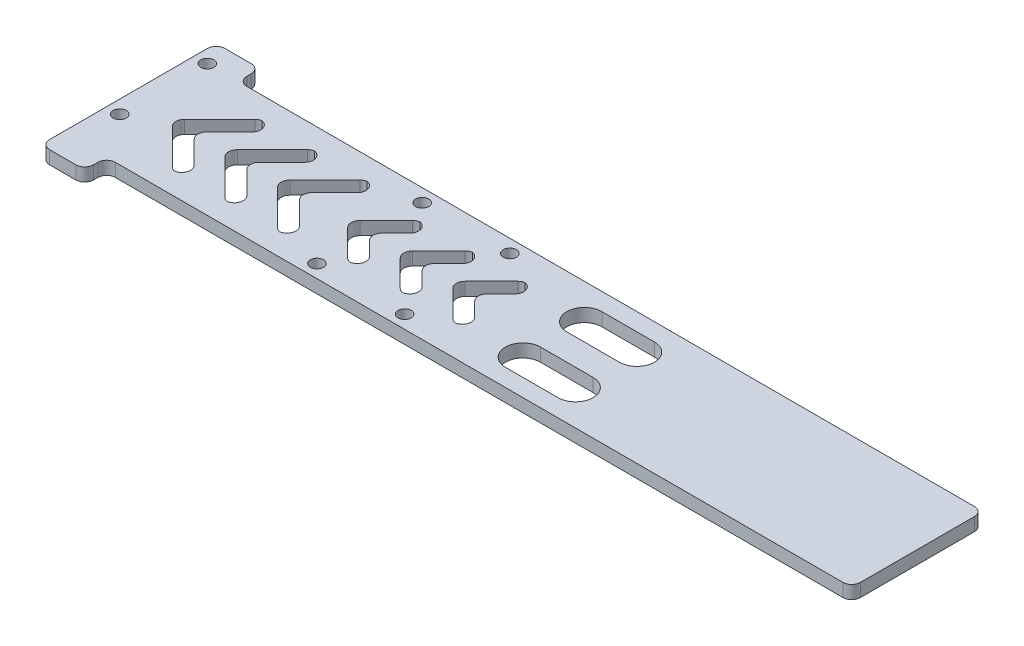
from build123d import *

# Parameters (mm, degrees)
SKETCH_1_R          = 1.5
EXTRUDE_1_DEPTH     = 3
CUT_EXTRUDE_1_DEPTH = 182.132548152
FILLET_1_R          = 2


with BuildPart() as part:
    # 草图1 → 凸台-拉伸1 (new body)
    with BuildSketch(Plane(origin=(0, 0, 0), x_dir=(1, 0, 0), z_dir=(0, 1, 0))):
        Polygon((10, -15), (180, -15), (180, 15), (10, 15), (10, 20), (0, 20), (0, -20), (10, -20), align=None)
        with Locations(Location((55, -12, 0), (0, 0, 270))):
            Circle(SKETCH_1_R, mode=Mode.SUBTRACT)
        with Locations(Location((75, -12, 0), (0, 0, 270))):
            Circle(SKETCH_1_R, mode=Mode.SUBTRACT)
        with Locations(Location((3, 15, 0), (0, 0, 270))):
            Circle(SKETCH_1_R, mode=Mode.SUBTRACT)
        with Locations(Location((3, -5, 0), (0, 0, 270))):
            Circle(SKETCH_1_R, mode=Mode.SUBTRACT)
        with Locations(Location((75, 12, 0), (0, 0, 270))):
            Circle(SKETCH_1_R, mode=Mode.SUBTRACT)
        with Locations(Location((55, 12, 0), (0, 0, 270))):
            Circle(SKETCH_1_R, mode=Mode.SUBTRACT)
    extrude(amount=EXTRUDE_1_DEPTH)

    # 草图2 → 切除-拉伸1 (cut, through all)
    with BuildSketch(Plane(origin=(0, 3, 0), x_dir=(1, 0, 0), z_dir=(0, 1, 0))):
        Polygon((20, 10), (10, 0), (20, -10), (25, -10), (15, 0), (25, 10), align=None)
        Polygon((32, -10), (22, 0), (32, 10), (37, 10), (27, 0), (37, -10), align=None)
        Polygon((44, -10), (34, 0), (44, 10), (49, 10), (39, 0), (49, -10), align=None)
        Polygon((50, 0), (58, 8), (63, 8), (55, 0), (63, -8), (58, -8), align=None)
        Polygon((75, -8), (67, 0), (75, 8), (70, 8), (62, 0), (70, -8), align=None)
        Polygon((87, -8), (79, 0), (87, 8), (82, 8), (74, 0), (82, -8), align=None)
        with BuildLine():
            Line((97, 11), (109, 11))
            ThreePointArc((109, 11), (113, 7), (109, 3))
            Line((109, 3), (97, 3))
            ThreePointArc((97, 3), (93, 7), (97, 11))
        make_face()
        with BuildLine():
            Line((97, -11), (109, -11))
            ThreePointArc((109, -11), (113, -7), (109, -3))
            Line((109, -3), (97, -3))
            ThreePointArc((97, -3), (93, -7), (97, -11))
        make_face()
    extrude(amount=-CUT_EXTRUDE_1_DEPTH, mode=Mode.SUBTRACT)

    # 圆角1
    # the kernel refuses this fillet: 2 mm, written as the material it adds along each edge
    with BuildSketch(Plane(origin=(10, 0, -15), x_dir=(1, 0, 0), z_dir=(0, 1, 0)), Plane(origin=(10, 3, 0), x_dir=(0.7071067811865515, 0, -0.7071067811865436), z_dir=(0, -1, 0)), Plane(origin=(34, 3, 0), x_dir=(0.7071067811865507, 0, -0.7071067811865445), z_dir=(0, -1, 0)), Plane(origin=(22, 3, 0), x_dir=(0.7071067811865511, 0, -0.7071067811865441), z_dir=(0, -1, 0)), Plane(origin=(62, 3, 0), x_dir=(0.7071067811865536, 0, -0.7071067811865415), z_dir=(0, -1, 0)), Plane(origin=(74, 3, 0), x_dir=(0.7071067811865546, 0, -0.7071067811865407), z_dir=(0, -1, 0))) as fillet_1_piece_1:
        with BuildLine():
            CenterArc((FILLET_1_R, FILLET_1_R), FILLET_1_R, 180, 90)
            Line((0, FILLET_1_R), (0, 0))
            Line((0, 0), (FILLET_1_R, 0))
        make_face()
    extrude(amount=3)
    with BuildSketch(Plane(origin=(10, 0, 15), x_dir=(1, 0, 0), z_dir=(0, 1, 0)), Plane(origin=(50, 3, 0), x_dir=(0.7071067811865553, 0, 0.7071067811865399), z_dir=(0, -1, 0))) as fillet_1_piece_2:
        with BuildLine():
            CenterArc((FILLET_1_R, -FILLET_1_R), FILLET_1_R, 90, 90)
            Line((0, -FILLET_1_R), (0, 0))
            Line((0, 0), (FILLET_1_R, 0))
        make_face()
    extrude(amount=3)
    with BuildSketch(Plane(origin=(20, 3, -10), x_dir=(-0.7071067811865507, 0, 0.7071067811865442), z_dir=(0, -1, 0)), Plane(origin=(44, 3, 10), x_dir=(1, 0, 0), z_dir=(0, -1, 0)), Plane(origin=(32, 3, 10), x_dir=(1, 0, 0), z_dir=(0, -1, 0))) as fillet_1_piece_3:
        with BuildLine():
            CenterArc((FILLET_1_R * 0.414213562373, -FILLET_1_R), FILLET_1_R, 90, 45)
            Line((-FILLET_1_R * 0.292893218813, -FILLET_1_R * 0.292893218813), (0, 0))
            Line((0, 0), (FILLET_1_R * 0.414213562373, 0))
        make_face()
    extrude(amount=3)
    with BuildSketch(Plane(origin=(20, 3, 10), x_dir=(-0.7071067811865507, 0, -0.7071067811865442), z_dir=(0, -1, 0)), Plane(origin=(44, 3, -10), x_dir=(1, 0, 0), z_dir=(0, -1, 0)), Plane(origin=(32, 3, -10), x_dir=(1, 0, 0), z_dir=(0, -1, 0)), Plane(origin=(70, 3, -8), x_dir=(1, 0, 0), z_dir=(0, -1, 0)), Plane(origin=(70, 3, 8), x_dir=(-0.707106781186555, 0, -0.70710678118654), z_dir=(0, -1, 0)), Plane(origin=(58, 3, 8), x_dir=(-0.7071067811865513, 0, -0.7071067811865438), z_dir=(0, -1, 0)), Plane(origin=(82, 3, -8), x_dir=(1, 0, 0), z_dir=(0, -1, 0)), Plane(origin=(82, 3, 8), x_dir=(-0.7071067811865583, 0, -0.7071067811865369), z_dir=(0, -1, 0)), Plane(origin=(58, 3, -8), x_dir=(1, 0, 0), z_dir=(0, -1, 0))) as fillet_1_piece_4:
        with BuildLine():
            CenterArc((FILLET_1_R * 0.414213562373, FILLET_1_R), FILLET_1_R, 225, 45)
            Line((-FILLET_1_R * 0.292893218813, FILLET_1_R * 0.292893218813), (0, 0))
            Line((0, 0), (FILLET_1_R * 0.414213562373, 0))
        make_face()
    extrude(amount=3)
    with BuildSketch(Plane(origin=(25, 3, 10), x_dir=(-1, 0, 0), z_dir=(0, -1, 0)), Plane(origin=(25, 3, -10), x_dir=(-0.7071067811865513, 0, 0.7071067811865436), z_dir=(0, -1, 0)), Plane(origin=(49, 3, 10), x_dir=(-1, 0, 0), z_dir=(0, -1, 0)), Plane(origin=(49, 3, -10), x_dir=(-0.7071067811865511, 0, 0.7071067811865439), z_dir=(0, -1, 0)), Plane(origin=(37, 3, 10), x_dir=(-1, 0, 0), z_dir=(0, -1, 0)), Plane(origin=(37, 3, -10), x_dir=(-0.707106781186551, 0, 0.707106781186544), z_dir=(0, -1, 0)), Plane(origin=(75, 3, -8), x_dir=(-0.7071067811865541, 0, 0.7071067811865409), z_dir=(0, -1, 0)), Plane(origin=(63, 3, -8), x_dir=(-0.7071067811865546, 0, 0.7071067811865406), z_dir=(0, -1, 0)), Plane(origin=(63, 3, 8), x_dir=(-1, 0, 0), z_dir=(0, -1, 0)), Plane(origin=(87, 3, -8), x_dir=(-0.7071067811865531, 0, 0.7071067811865421), z_dir=(0, -1, 0))) as fillet_1_piece_5:
        with BuildLine():
            CenterArc((FILLET_1_R * 2.41421356237, FILLET_1_R), FILLET_1_R, 135, 135)
            Line((FILLET_1_R * 1.70710678119, FILLET_1_R * 1.70710678119), (0, 0))
            Line((0, 0), (FILLET_1_R * 2.41421356237, 0))
        make_face()
    extrude(amount=3)
    with BuildSketch(Plane(origin=(75, 3, 8), x_dir=(-0.7071067811865545, 0, -0.7071067811865405), z_dir=(0, -1, 0)), Plane(origin=(87, 3, 8), x_dir=(-0.7071067811865538, 0, -0.7071067811865415), z_dir=(0, -1, 0))) as fillet_1_piece_6:
        with BuildLine():
            CenterArc((FILLET_1_R * 2.41421356237, -FILLET_1_R), FILLET_1_R, 90, 135)
            Line((FILLET_1_R * 1.70710678119, -FILLET_1_R * 1.70710678119), (0, 0))
            Line((0, 0), (FILLET_1_R * 2.41421356237, 0))
        make_face()
    extrude(amount=3)
    # the kernel refuses this fillet: 2 mm, written as the material it takes off along each edge
    with BuildSketch(Plane(origin=(10, -5, -20), x_dir=(0, 0, 1), z_dir=(0, 1, 0)), Plane(origin=(180, -5, -15), x_dir=(0, 0, 1), z_dir=(0, 1, 0)), Plane(origin=(180, -5, 15), x_dir=(-1, 0, 0), z_dir=(0, 1, 0)), Plane(origin=(15, 8, 0), x_dir=(0.7071067811865511, 0, 0.707106781186544), z_dir=(0, -1, 0)), Plane(origin=(39, 8, 0), x_dir=(0.7071067811865508, 0, 0.7071067811865444), z_dir=(0, -1, 0)), Plane(origin=(27, 8, 0), x_dir=(0.7071067811865503, 0, 0.7071067811865448), z_dir=(0, -1, 0)), Plane(origin=(67, 8, 0), x_dir=(0.7071067811865541, 0, 0.7071067811865411), z_dir=(0, -1, 0)), Plane(origin=(55, 8, 0), x_dir=(0.7071067811865553, 0, 0.7071067811865397), z_dir=(0, -1, 0)), Plane(origin=(79, 8, 0), x_dir=(0.7071067811865511, 0, 0.7071067811865439), z_dir=(0, -1, 0))) as fillet_1_2_piece_1:
        with BuildLine():
            CenterArc((FILLET_1_R, -FILLET_1_R), FILLET_1_R, 90, 90)
            Line((0, -FILLET_1_R), (0, 0))
            Line((0, 0), (FILLET_1_R, 0))
        make_face()
    extrude(amount=13, mode=Mode.SUBTRACT)
    with BuildSketch(Plane(origin=(10, -5, 20), x_dir=(0, 0, -1), z_dir=(0, 1, 0)), Plane(origin=(0, -5, 20), x_dir=(1, 0, 0), z_dir=(0, 1, 0)), Plane(origin=(0, -5, -20), x_dir=(0, 0, 1), z_dir=(0, 1, 0))) as fillet_1_2_piece_2:
        with BuildLine():
            CenterArc((FILLET_1_R, FILLET_1_R), FILLET_1_R, 180, 90)
            Line((0, FILLET_1_R), (0, 0))
            Line((0, 0), (FILLET_1_R, 0))
        make_face()
    extrude(amount=13, mode=Mode.SUBTRACT)


solid = part.part
